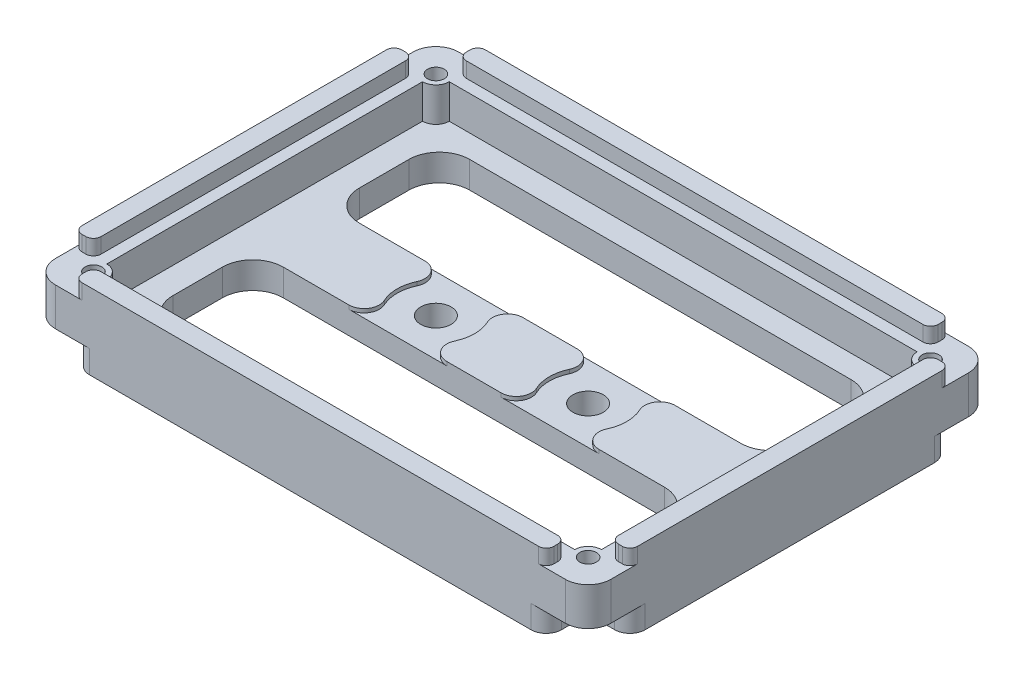
from build123d import *

# Parameters (mm, degrees)
ESQUISSE1_W             = 73
ESQUISSE1_H             = 53
ESQUISSE1_R             = 1.1
ESQUISSE1_W_2           = 62.111111112
ESQUISSE1_H_2           = 43
BOSS_EXTRU_1_DEPTH      = 10
ESQUISSE2_W             = 73
ESQUISSE2_H             = 53
BOSS_EXTRU_2_DEPTH      = 4
ESQUISSE3_W             = 5.5
ESQUISSE3_H             = 5.5
ENL_V_MAT_EXTRU_1_DEPTH = 3
ENL_V_START             = -5
ESQUISSE4_R             = 1.1
ENL_V_MAT_EXTRU_2_DEPTH = 5
CONG_3_R                = 3
ESQUISSE5_R             = 2
ESQUISSE5_W             = 58.111111112
ESQUISSE5_H             = 14.5
ENL_V_MAT_EXTRU_3_DEPTH = 5
CONG_4_R                = 4
CONG_5_R                = 2
ESQUISSE6_R             = 5.1
ENL_V_MAT_EXTRU_6_DEPTH = 1
CONG_6_R                = 2
ENL_V_MAT_EXTRU_7_DEPTH = 6.5
ESQUISSE8_W             = 68
ESQUISSE8_H             = 48
ENL_V_MAT_EXTRU_8_DEPTH = 2
ESQUISSE9_W             = 5.5
ESQUISSE9_H             = 5.5
ENL_V_MAT_EXTRU_9_DEPTH = 2
CONG_8_R                = 1


with BuildPart() as part:
    # Esquisse1 → Boss.-Extru.1 (new body)
    with BuildSketch(Plane(origin=(0, 0, 0), x_dir=(1, 0, 0), z_dir=(0, 1, 0))):
        Rectangle(ESQUISSE1_W, ESQUISSE1_H)
        with Locations((-32.5, 22.5)):
            Circle(ESQUISSE1_R, mode=Mode.SUBTRACT)
        with Locations((32.5, 22.5)):
            Circle(ESQUISSE1_R, mode=Mode.SUBTRACT)
        with Locations((32.5, -22.5)):
            Circle(ESQUISSE1_R, mode=Mode.SUBTRACT)
        with Locations((-32.5, -22.5)):
            Circle(ESQUISSE1_R, mode=Mode.SUBTRACT)
        Rectangle(ESQUISSE1_W_2, ESQUISSE1_H_2, mode=Mode.SUBTRACT)
    extrude(amount=BOSS_EXTRU_1_DEPTH)

    # Esquisse2 → Boss.-Extru.2 (add)
    with BuildSketch(Plane.XZ):
        Rectangle(ESQUISSE2_W, ESQUISSE2_H)
    extrude(amount=-BOSS_EXTRU_2_DEPTH)

    # Esquisse3 → Enlèv. mat.-Extru.1 (cut)
    with BuildSketch(Plane.XZ):
        with Locations((-33.75, 23.75)):
            Rectangle(ESQUISSE3_W, ESQUISSE3_H)
        with Locations((33.75, 23.75)):
            Rectangle(ESQUISSE3_W, ESQUISSE3_H)
        with Locations((33.75, -23.75)):
            Rectangle(ESQUISSE3_W, ESQUISSE3_H)
        with Locations((-33.75, -23.75)):
            Rectangle(ESQUISSE3_W, ESQUISSE3_H)
    extrude(amount=-ENL_V_MAT_EXTRU_1_DEPTH, mode=Mode.SUBTRACT)

    # Esquisse4 → Enlèv. mat.-Extru.2 (cut)
    with BuildSketch(Plane(origin=(0, 4, 0), x_dir=(1, 0, 0), z_dir=(0, 1, 0)).offset(ENL_V_START)):
        with Locations((-32.5, 22.5)):
            Circle(ESQUISSE4_R)
        with Locations((32.5, 22.5)):
            Circle(ESQUISSE4_R)
        with Locations((32.5, -22.5)):
            Circle(ESQUISSE4_R)
        with Locations((-32.5, -22.5)):
            Circle(ESQUISSE4_R)
    extrude(amount=ENL_V_MAT_EXTRU_2_DEPTH, mode=Mode.SUBTRACT)

    # Congé3
    cong_3_edges = [part.edges().sort_by_distance(p)[0] for p in [
        (-36.5, 6.5, 26.5),
        (-36.5, 6.5, -26.5),
        (36.5, 6.5, -26.5),
        (36.5, 6.5, 26.5),
    ]]
    fillet(cong_3_edges, radius=CONG_3_R)

    # Esquisse5 → Enlèv. mat.-Extru.3 (cut)
    with BuildSketch(Plane(origin=(0, 4, 0), x_dir=(1, 0, 0), z_dir=(0, 1, 0))):
        with Locations((-10, 0)):
            Circle(ESQUISSE5_R)
        with Locations((10, 0)):
            Circle(ESQUISSE5_R)
        with Locations((0, 12.25)):
            Rectangle(ESQUISSE5_W, ESQUISSE5_H)
        with Locations((0, -12.25)):
            Rectangle(ESQUISSE5_W, ESQUISSE5_H)
    extrude(amount=-ENL_V_MAT_EXTRU_3_DEPTH, mode=Mode.SUBTRACT)

    # Congé4
    cong_4_edges = [part.edges().sort_by_distance(p)[0] for p in [
        (-29.055555556, 2, 19.5),
        (29.055555556, 2, 5),
        (29.055555556, 2, 19.5),
        (-29.055555556, 2, 5),
        (29.055555556, 2, -5),
        (29.055555556, 2, -19.5),
        (-29.055555556, 2, -19.5),
        (-29.055555556, 2, -5),
    ]]
    fillet(cong_4_edges, radius=CONG_4_R)

    # Congé5
    cong_5_edges = [part.edges().sort_by_distance(p)[0] for p in [
        (-31, 1.5, -21),
        (-31, 1.5, 21),
        (31, 1.5, 21),
        (31, 1.5, -21),
        (-36.5, 1.5, 21),
        (-31, 1.5, 26.5),
        (31, 1.5, 26.5),
        (36.5, 1.5, 21),
        (36.5, 1.5, -21),
        (31, 1.5, -26.5),
        (-31, 1.5, -26.5),
        (-36.5, 1.5, -21),
    ]]
    fillet(cong_5_edges, radius=CONG_5_R)

    # Esquisse6 → Enlèv. mat.-Extru.6 (cut)
    with BuildSketch(Plane(origin=(0, 4, 0), x_dir=(1, 0, 0), z_dir=(0, 1, 0))):
        with Locations((-10, 0)):
            Circle(ESQUISSE6_R)
        with Locations((10, 0)):
            Circle(ESQUISSE6_R)
    extrude(amount=-ENL_V_MAT_EXTRU_6_DEPTH, mode=Mode.SUBTRACT)

    # Congé6
    cong_6_edges = [part.edges().sort_by_distance(p)[0] for p in [
        (8.995012438, 3.5, 5),
        (8.995012438, 3.5, -5),
        (11.004987562, 3.5, -5),
        (11.004987562, 3.5, 5),
        (-11.004987562, 3.5, 5),
        (-8.995012438, 3.5, 5),
        (-11.004987562, 3.5, -5),
        (-8.995012438, 3.5, -5),
    ]]
    fillet(cong_6_edges, radius=CONG_6_R)

    # Esquisse7 → Enlèv. mat.-Extru.7 (cut)
    with BuildSketch(Plane(origin=(0, 10, 0), x_dir=(1, 0, 0), z_dir=(0, 1, 0))):
        with BuildLine():
            Line((-32.5, 20.743179078), (-32.5, -20.743179078))
            ThreePointArc((-32.5, -20.743179078), (-31.257740013, -21.257740013), (-30.743179078, -22.5))
            Line((-30.743179078, -22.5), (30.743179078, -22.5))
            ThreePointArc((30.743179078, -22.5), (31.257740013, -21.257740013), (32.5, -20.743179078))
            Line((32.5, -20.743179078), (32.5, 20.743179078))
            ThreePointArc((32.5, 20.743179078), (31.257740013, 21.257740013), (30.743179078, 22.5))
            Line((30.743179078, 22.5), (-30.743179078, 22.5))
            ThreePointArc((-30.743179078, 22.5), (-31.257740013, 21.257740013), (-32.5, 20.743179078))
        make_face()
    extrude(amount=-ENL_V_MAT_EXTRU_7_DEPTH, mode=Mode.SUBTRACT)

    # Esquisse8 → Enlèv. mat.-Extru.8 (cut)
    with BuildSketch(Plane(origin=(0, 10, 0), x_dir=(1, 0, 0), z_dir=(0, 1, 0))):
        Rectangle(ESQUISSE8_W, ESQUISSE8_H)
    extrude(amount=-ENL_V_MAT_EXTRU_8_DEPTH, mode=Mode.SUBTRACT)

    # Esquisse9 → Enlèv. mat.-Extru.9 (cut)
    with BuildSketch(Plane(origin=(0, 10, 0), x_dir=(-1, 0, 0), z_dir=(0, 1, 0))):
        with Locations((-33.75, 23.75)):
            Rectangle(ESQUISSE9_W, ESQUISSE9_H)
        with Locations((33.75, 23.75)):
            Rectangle(ESQUISSE9_W, ESQUISSE9_H)
        with Locations((33.75, -23.75)):
            Rectangle(ESQUISSE9_W, ESQUISSE9_H)
        with Locations((-33.75, -23.75)):
            Rectangle(ESQUISSE9_W, ESQUISSE9_H)
    extrude(amount=-ENL_V_MAT_EXTRU_9_DEPTH, mode=Mode.SUBTRACT)

    # Congé8
    cong_8_edges = [part.edges().sort_by_distance(p)[0] for p in [
        (-31, 9, 26.5),
        (-31, 9, 24),
        (31, 9, 26.5),
        (31, 9, 24),
        (36.5, 9, 21),
        (34, 9, 21),
        (31, 9, -26.5),
        (31, 9, -24),
        (34, 9, -21),
        (36.5, 9, -21),
        (-31, 9, -24),
        (-31, 9, -26.5),
        (-36.5, 9, -21),
        (-34, 9, -21),
        (-36.5, 9, 21),
        (-34, 9, 21),
    ]]
    fillet(cong_8_edges, radius=CONG_8_R)


solid = part.part
